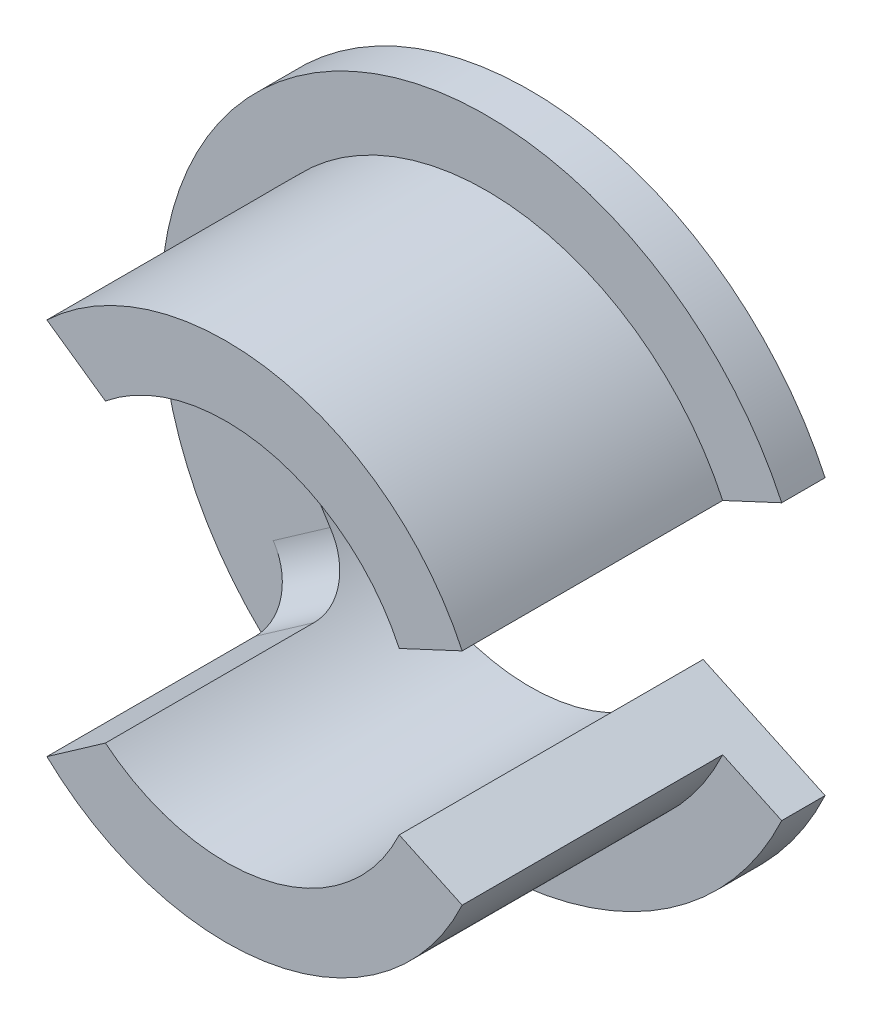
from build123d import *

# Parameters (mm, degrees)
BOSS_EXTRUDE1_DEPTH = 6
BOSS_EXTRUDE2_START = 1
BOSS_EXTRUDE2_DEPTH = 1
CUT_EXTRUDE1_START  = -6
CUT_EXTRUDE1_DEPTH  = 6
CUT_EXTRUDE2_START  = -6
CUT_EXTRUDE2_DEPTH  = 6
FILLET1_R           = 1.2


with BuildPart() as part:
    # Sketch1 → Boss-Extrude1 (new body)
    with BuildSketch(Plane.XY):
        with BuildLine():
            Line((3.987754263, 1.859520352), (5.437846722, 2.53570957))
            ThreePointArc((5.437846722, 2.53570957), (-6, 0), (5.437846722, -2.53570957))
            Line((5.437846722, -2.53570957), (3.987754263, -1.859520352))
            ThreePointArc((3.987754263, -1.859520352), (-4.4, 0), (3.987754263, 1.859520352))
        make_face()
    extrude(amount=BOSS_EXTRUDE1_DEPTH)

    # Sketch2 → Boss-Extrude2 (add)
    with BuildSketch(Plane(origin=(0, 0, 0), x_dir=(-1, 0, 0), z_dir=(0, 0, -1)).offset(BOSS_EXTRUDE2_START)):
        with BuildLine():
            Line((-3.987754263, -1.859520352), (-5.437846722, -2.53570957))
            ThreePointArc((-5.437846722, -2.53570957), (6, 0), (-5.437846722, 2.53570957))
            Line((-5.437846722, 2.53570957), (-3.987754263, 1.859520352))
            ThreePointArc((-3.987754263, 1.859520352), (4.4, 0), (-3.987754263, -1.859520352))
        make_face()
        with BuildLine():
            Line((-6.797308403, 3.169636963), (-5.437846722, 2.53570957))
            ThreePointArc((-5.437846722, 2.53570957), (6, 0), (-5.437846722, -2.53570957))
            Line((-5.437846722, -2.53570957), (-6.797308403, -3.169636963))
            ThreePointArc((-6.797308403, -3.169636963), (1.623297105, -7.322220053), (7.5, 0))
            ThreePointArc((7.5, 0), (1.623297105, 7.322220053), (-6.797308403, 3.169636963))
        make_face()
    extrude(amount=-BOSS_EXTRUDE2_DEPTH)

    # Sketch3 → Cut-Extrude1 (cut)
    with BuildSketch(Plane.XY.offset(6).offset(CUT_EXTRUDE1_START)):
        with BuildLine():
            ThreePointArc((-5.503902596, -2.388944581), (-4.914912266, -3.441458618), (-4.127319149, -4.354909487))
            Line((-4.127319149, -4.354909487), (-2.779344429, -3.411047427))
            ThreePointArc((-2.779344429, -3.411047427), (-3.604268995, -2.52373632), (-4.155927876, -1.44508252))
            Line((-4.155927876, -1.44508252), (-5.503902596, -2.388944581))
        make_face()
        with BuildLine():
            ThreePointArc((-5.376200178, 5.229385398), (-6.143640332, 4.301823273), (-6.752783625, 3.263420492))
            Line((-6.752783625, 3.263420492), (-5.503902596, 2.388944581))
            ThreePointArc((-5.503902596, 2.388944581), (-4.914912266, 3.441458618), (-4.127319149, 4.354909487))
            Line((-4.127319149, 4.354909487), (-5.376200178, 5.229385398))
        make_face()
        with BuildLine():
            ThreePointArc((-4.127319149, 4.354909487), (-4.914912266, 3.441458618), (-5.503902596, 2.388944581))
            Line((-5.503902596, 2.388944581), (-4.155927876, 1.44508252))
            ThreePointArc((-4.155927876, 1.44508252), (-3.604268995, 2.52373632), (-2.779344429, 3.411047427))
            Line((-2.779344429, 3.411047427), (-4.127319149, 4.354909487))
        make_face()
        with BuildLine():
            ThreePointArc((-6.752783625, -3.263420492), (-6.143640332, -4.301823273), (-5.376200178, -5.229385398))
            Line((-5.376200178, -5.229385398), (-4.127319149, -4.354909487))
            ThreePointArc((-4.127319149, -4.354909487), (-4.914912266, -3.441458618), (-5.503902596, -2.388944581))
            Line((-5.503902596, -2.388944581), (-6.752783625, -3.263420492))
        make_face()
    extrude(amount=CUT_EXTRUDE1_DEPTH, mode=Mode.SUBTRACT)

    # Sketch4 → Cut-Extrude2 (cut)
    with BuildSketch(Plane.XY.offset(6).offset(CUT_EXTRUDE2_START)):
        with BuildLine():
            Line((-4.155927876, 1.44508252), (-5.503902596, 2.388944581))
            ThreePointArc((-5.503902596, 2.388944581), (-6, 0), (-5.503902596, -2.388944581))
            Line((-5.503902596, -2.388944581), (-4.155927876, -1.44508252))
            ThreePointArc((-4.155927876, -1.44508252), (-4.4, 0), (-4.155927876, 1.44508252))
        make_face()
    extrude(amount=CUT_EXTRUDE2_DEPTH, mode=Mode.SUBTRACT)

    # Fillet1
    # the kernel refuses this fillet: 1.2 mm, written as the material it adds along each edge
    with BuildSketch(Plane(origin=(-0.321888296, 1.690318118, 0), x_dir=(0, 0, 1), z_dir=(-0.8191520442889906, 0.5735764363510478, 0))) as fillet1_piece_1_section:
        with BuildLine():
            CenterArc((FILLET1_R, -FILLET1_R), FILLET1_R, 90, 90)
            Line((0, -FILLET1_R), (0, 0))
            Line((0, 0), (FILLET1_R, 0))
        make_face()
    fillet1_piece_1 = extrude(amount=7.645573285, mode=Mode.PRIVATE)
    fillet1_piece_1 = fillet1_piece_1 - Plane(origin=(0, 0, 0.272987798), x_dir=(0.9063077870366507, -0.4226182617406978, 0), z_dir=(0, 0, -1)) * Cylinder(4.4, 21, mode=Mode.PRIVATE)
    fillet1_piece_1 = fillet1_piece_1 & Plane(origin=(0, 0, 0.272987798), x_dir=(0.9063077870366507, 0.4226182617406977, 0), z_dir=(0, 0, -1)) * Cylinder(6, 21, mode=Mode.PRIVATE)
    with BuildSketch(Plane(origin=(-6.584775282, -6.075638796, 0), x_dir=(-0.5735764363510464, 0.8191520442889915, 0), z_dir=(0.8191520442889916, 0.5735764363510465, 0))) as fillet1_piece_2_section:
        with BuildLine():
            CenterArc((FILLET1_R, FILLET1_R), FILLET1_R, 180, 90)
            Line((0, FILLET1_R), (0, 0))
            Line((0, 0), (FILLET1_R, 0))
        make_face()
    fillet1_piece_2 = extrude(amount=7.645573285, mode=Mode.PRIVATE)
    fillet1_piece_2 = fillet1_piece_2 - Plane(origin=(0, 0, 0.272987172), x_dir=(0.9063077870366507, 0.4226182617406977, 0), z_dir=(0, 0, -1)) * Cylinder(4.4, 21, mode=Mode.PRIVATE)
    fillet1_piece_2 = fillet1_piece_2 & Plane(origin=(0, 0, 0.272987172), x_dir=(0.9063077870366507, 0.4226182617406977, 0), z_dir=(0, 0, -1)) * Cylinder(6, 21, mode=Mode.PRIVATE)
    add([fillet1_piece_1, fillet1_piece_2])


solid = part.part
